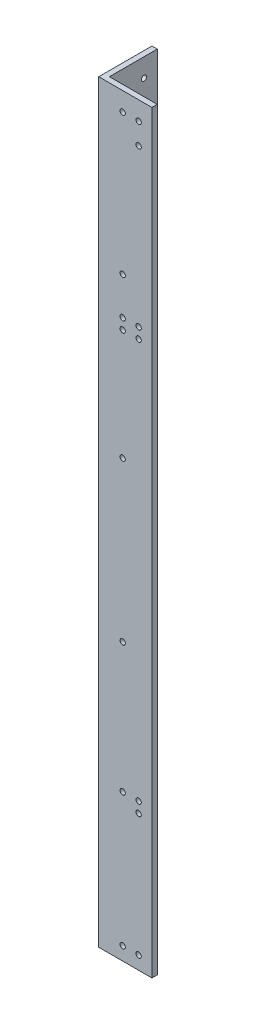
from build123d import *

# Parameters (mm, degrees)
BOSS_EXTRUDE1_DEPTH               = 450
BACKSIDEHOLES_SKETCH3_R           = 1.5875
BACKSIDEHOLES_CUT_EXTRUDE1_DEPTH  = 3.175
RIGHTSIDEHOLES_SKETCH4_R          = 1.5875
RIGHTSIDEHOLES_CUT_EXTRUDE2_DEPTH = 3.175


with BuildPart() as part:
    # Sketch2 → Boss-Extrude1 (new body)
    with BuildSketch(Plane(origin=(0, 0, 0), x_dir=(1, 0, 0), z_dir=(0, 1, 0))):
        Polygon((0, 31.75), (3.175, 31.75), (3.175, 3.175), (31.75, 3.175), (31.75, 0), (0, 0), align=None)
    extrude(amount=BOSS_EXTRUDE1_DEPTH)

    # BackSideHoles-Sketch3 → BackSideHoles-Cut-Extrude1 (cut)
    with BuildSketch(Plane.XY):
        with Locations((23.8125, 81.1125)):
            Circle(BACKSIDEHOLES_SKETCH3_R)
        with Locations((14.2875, 87.4625)):
            Circle(BACKSIDEHOLES_SKETCH3_R)
        with Locations((23.8125, 87.4625)):
            Circle(BACKSIDEHOLES_SKETCH3_R)
        with Locations((14.2875, 438.8875)):
            Circle(BACKSIDEHOLES_SKETCH3_R)
        with Locations((23.8125, 438.8875)):
            Circle(BACKSIDEHOLES_SKETCH3_R)
        with Locations((23.8125, 426.1875)):
            Circle(BACKSIDEHOLES_SKETCH3_R)
        with Locations((14.2875, 332.602644)):
            Circle(BACKSIDEHOLES_SKETCH3_R)
        with Locations((23.8125, 332.602644)):
            Circle(BACKSIDEHOLES_SKETCH3_R)
        with Locations((14.2875, 326.252644)):
            Circle(BACKSIDEHOLES_SKETCH3_R)
        with Locations((23.8125, 326.252644)):
            Circle(BACKSIDEHOLES_SKETCH3_R)
        with Locations((14.2875, 165)):
            Circle(BACKSIDEHOLES_SKETCH3_R)
        with Locations((14.2875, 260)):
            Circle(BACKSIDEHOLES_SKETCH3_R)
        with Locations((14.2875, 355)):
            Circle(BACKSIDEHOLES_SKETCH3_R)
        with Locations((14.2875, 7.9375)):
            Circle(BACKSIDEHOLES_SKETCH3_R)
        with Locations((23.8125, 7.9375)):
            Circle(BACKSIDEHOLES_SKETCH3_R)
    extrude(amount=-BACKSIDEHOLES_CUT_EXTRUDE1_DEPTH, mode=Mode.SUBTRACT)

    # RightSideHoles-Sketch4 → RightSideHoles-Cut-Extrude2 (cut)
    with BuildSketch(Plane.ZY):
        with Locations((-23.8125, 81.1125)):
            Circle(RIGHTSIDEHOLES_SKETCH4_R)
        with Locations((-23.8125, 87.4625)):
            Circle(RIGHTSIDEHOLES_SKETCH4_R)
        with Locations((-23.8125, 438.8875)):
            Circle(RIGHTSIDEHOLES_SKETCH4_R)
        with Locations((-14.2875, 426.1875)):
            Circle(RIGHTSIDEHOLES_SKETCH4_R)
        with Locations((-23.8125, 426.1875)):
            Circle(RIGHTSIDEHOLES_SKETCH4_R)
        with Locations((-23.8125, 332.602644)):
            Circle(RIGHTSIDEHOLES_SKETCH4_R)
        with Locations((-14.2875, 332.602644)):
            Circle(RIGHTSIDEHOLES_SKETCH4_R)
        with Locations((-23.8125, 319.902644)):
            Circle(RIGHTSIDEHOLES_SKETCH4_R)
        with Locations((-14.2875, 319.902644)):
            Circle(RIGHTSIDEHOLES_SKETCH4_R)
        with Locations((-23.8125, 7.9375)):
            Circle(RIGHTSIDEHOLES_SKETCH4_R)
        with Locations((-14.2875, 7.9375)):
            Circle(RIGHTSIDEHOLES_SKETCH4_R)
        with Locations((-14.2875, 165)):
            Circle(RIGHTSIDEHOLES_SKETCH4_R)
        with Locations((-14.2875, 260)):
            Circle(RIGHTSIDEHOLES_SKETCH4_R)
        with Locations((-14.2875, 355)):
            Circle(RIGHTSIDEHOLES_SKETCH4_R)
        with Locations((-14.2875, 81.1125)):
            Circle(RIGHTSIDEHOLES_SKETCH4_R)
    extrude(amount=-RIGHTSIDEHOLES_CUT_EXTRUDE2_DEPTH, mode=Mode.SUBTRACT)


solid = part.part
